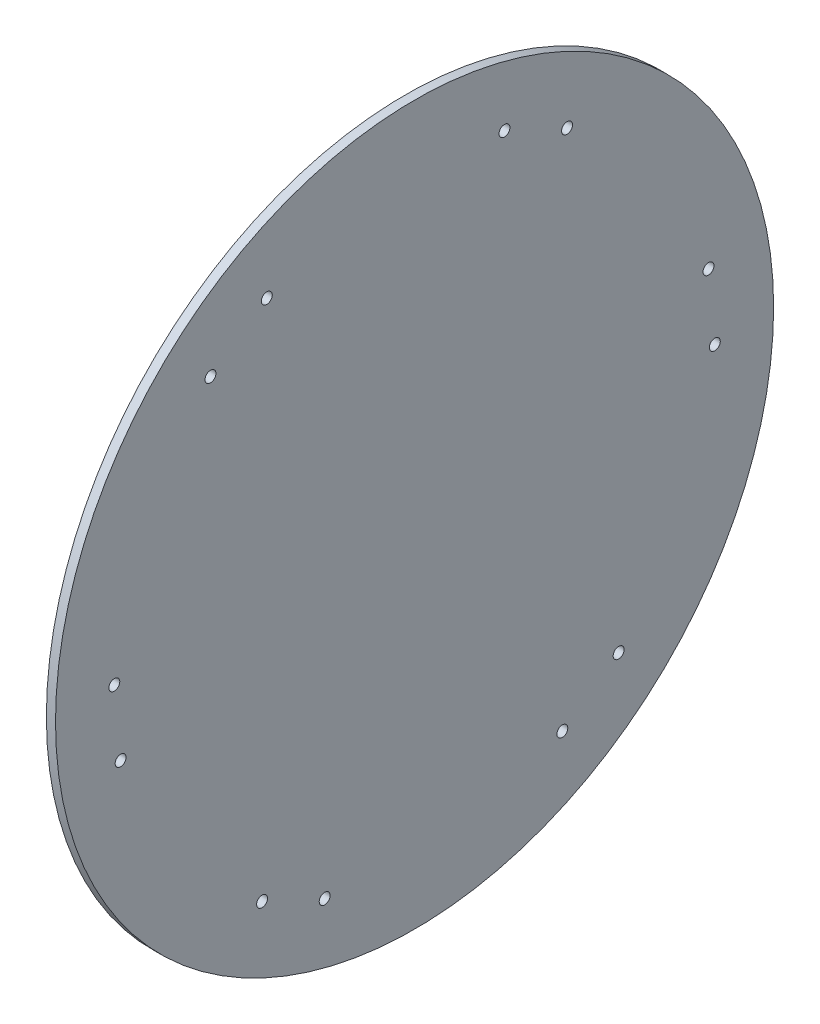
from build123d import *

# Parameters (mm, degrees)
SKETCH2_R           = 125
BOSS_EXTRUDE1_DEPTH = 3.18
SKETCH3_R           = 1.9
CUT_EXTRUDE1_DEPTH  = 177.80529517


with BuildPart() as part:
    # Sketch2 → Boss-Extrude1 (new body)
    with BuildSketch(Plane(origin=(0, 0, 0), x_dir=(0, 0, -1), z_dir=(1, 0, 0))):
        Circle(SKETCH2_R)
    extrude(amount=BOSS_EXTRUDE1_DEPTH)

    # Sketch3 → Cut-Extrude1 (cut, through all)
    with BuildSketch(Plane.ZY):
        with Locations((104.523481263, 0.949898407)):
            Circle(SKETCH3_R)
        with Locations((102.331811398, -22.949820906)):
            Circle(SKETCH3_R)
        with Locations((31.290777782, -100.096858738)):
            Circle(SKETCH3_R)
        with Locations((53.084376783, -90.045040862)):
            Circle(SKETCH3_R)
        with Locations((-51.43910448, -90.994939269)):
            Circle(SKETCH3_R)
        with Locations((-71.041033615, -77.147037833)):
            Circle(SKETCH3_R)
        with Locations((-102.331811398, 22.949820906)):
            Circle(SKETCH3_R)
        with Locations((-104.523481263, -0.949898407)):
            Circle(SKETCH3_R)
        with Locations((-53.084376783, 90.045040862)):
            Circle(SKETCH3_R)
        with Locations((-31.290777782, 100.096858738)):
            Circle(SKETCH3_R)
        with Locations((51.43910448, 90.994939269)):
            Circle(SKETCH3_R)
        with Locations((71.041033615, 77.147037833)):
            Circle(SKETCH3_R)
    extrude(amount=-CUT_EXTRUDE1_DEPTH, mode=Mode.SUBTRACT)


solid = part.part
